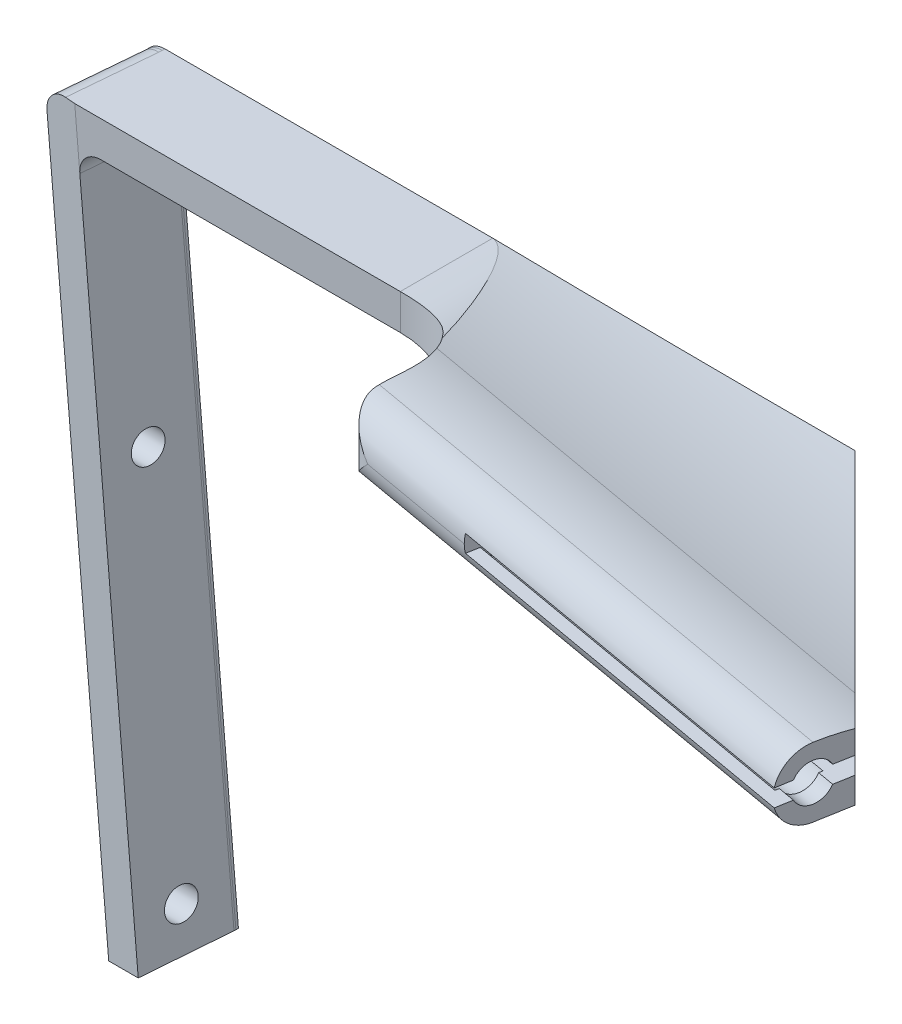
from build123d import *

# Parameters (mm, degrees)
OVERALLGEOMETRY_BOSS_EXTRUDE1_DEPTH = 0.254
CAMERAPITCH_BOSS_EXTRUDE2_DEPTH     = 56.109378
BOSS_EXTRUDE3_DEPTH                 = 5.08
SKETCH3_R                           = 1.143
CUT_EXTRUDE1_DEPTH                  = 97.064287471
CUT_EXTRUDE2_DEPTH                  = 27.94
BOSS_EXTRUDE4_DEPTH                 = 1.27
CUT_EXTRUDE4_DEPTH                  = 95.187753464
CUT_EXTRUDE5_DEPTH                  = 98.850191818
FILLET1_R                           = 2.54
FILLET2_R                           = 7.62
SKETCH10_R                          = 51.133924518
CUT_EXTRUDE6_DEPTH                  = 95.075440862
FILLET3_R                           = 2.54
FILLET4_R                           = 17.78
CUT_EXTRUDE8_DEPTH                  = 94.555694116
CUT_EXTRUDE8_DEPTH_BACK             = 94.555694116
FILLET14_R                          = 1.524
FILLET15_R                          = 1.524
FILLET16_R                          = 1.524
FILLET17_R                          = 1.524


with BuildPart() as part:
    # Sketch1 → OverallGeometry-Boss-Extrude1 (new body)
    with BuildSketch(Plane.XY):
        Polygon((0, 0), (76.2, 0), (76.2, -5.08), (2.853610021, -5.08), (7.281121752, -55.686690663), (4.890254477, -55.895864446), align=None)
    extrude(amount=OVERALLGEOMETRY_BOSS_EXTRUDE1_DEPTH)

    # Sketch2 → CameraPitch-Boss-Extrude2 (add)
    with BuildSketch(Plane(origin=(4.890254477, -55.895864446, 0), x_dir=(0.9961946980917449, 0.08715574274766635, 0), z_dir=(0.08715574274766635, -0.9961946980917449, 0))):
        Polygon((2.4, 0.254), (1.828330337, 6.788214146), (-0.553438966, 6.579836333), (0, 0.254), align=None)
    extrude(amount=-CAMERAPITCH_BOSS_EXTRUDE2_DEPTH)

    # Sketch4 → Boss-Extrude3 (add)
    with BuildSketch(Plane.XZ.offset(5.08)):
        Polygon((76.2, 0.254), (71.789336287, 25.268116927), (33.571372988, 18.529258849), (33.571372988, 6.788214146), (-1.988627012, 6.788214146), (-1.419132725, 0.254), (-1.419132725, 0), (76.2, 0), align=None)
    extrude(amount=-BOSS_EXTRUDE3_DEPTH)

    # Sketch3 → Cut-Extrude1 (cut, through all)
    with BuildSketch(Plane(origin=(2.394675351, 0.209506946, 0.210307229), x_dir=(0.1097410378717943, -0.30459177963520256, -0.9461399222025683), z_dir=(0.9924038765061032, 0.08682408883347342, 0.08715574274766114))):
        with Locations(Location((4.583283833, -24.85972329, 0), (0, 0, 17.803073687))):
            Circle(SKETCH3_R)
        with Locations(Location((13.32842777, -51.395850692, 0), (0, 0, 17.803073687))):
            Circle(SKETCH3_R)
    extrude(amount=-CUT_EXTRUDE1_DEPTH, mode=Mode.SUBTRACT)

    # Sketch5 → Cut-Extrude2 (cut)
    with BuildSketch(Plane(origin=(73.94572541, 0, 13.038626498), x_dir=(0.1736481776669353, 0, -0.9848077530122074), z_dir=(0.9848077530122074, 0, 0.1736481776669353))):
        with BuildLine():
            Line((-12.418150031, -1.905), (-11.402150031, -1.905))
            ThreePointArc((-11.402150031, -1.905), (-9.878150031, -0.889), (-8.354150031, -1.905))
            Line((-8.354150031, -1.905), (-4.544150031, -1.905))
            Line((-4.544150031, -1.905), (-4.544150031, -3.175))
            Line((-4.544150031, -3.175), (-8.354150031, -3.175))
            ThreePointArc((-8.354150031, -3.175), (-9.878150031, -4.191), (-11.402150031, -3.175))
            Line((-11.402150031, -3.175), (-12.418150031, -3.175))
            Line((-12.418150031, -3.175), (-12.418150031, -1.905))
        make_face()
    extrude(amount=-CUT_EXTRUDE2_DEPTH, mode=Mode.SUBTRACT)

    # Sketch6 → Boss-Extrude4 (add)
    with BuildSketch(Plane(origin=(73.94572541, 0, 13.038626498), x_dir=(0.1736481776669353, 0, -0.9848077530122074), z_dir=(0.9848077530122074, 0, 0.1736481776669353))):
        with BuildLine():
            Line((-11.402150031, -1.905), (-11.12249082, -1.905))
            ThreePointArc((-11.12249082, -1.905), (-9.878150031, -1.143), (-8.633809242, -1.905))
            Line((-8.633809242, -1.905), (-8.354150031, -1.905))
            ThreePointArc((-8.354150031, -1.905), (-9.878150031, -0.889), (-11.402150031, -1.905))
        make_face()
        with BuildLine():
            Line((-8.354150031, -3.175), (-8.633809242, -3.175))
            ThreePointArc((-8.633809242, -3.175), (-9.878150031, -3.937), (-11.12249082, -3.175))
            Line((-11.12249082, -3.175), (-11.402150031, -3.175))
            ThreePointArc((-11.402150031, -3.175), (-9.878150031, -4.191), (-8.354150031, -3.175))
        make_face()
    extrude(amount=-BOSS_EXTRUDE4_DEPTH)

    # Sketch8 → Cut-Extrude4 (cut, through all)
    with BuildSketch(Plane(origin=(4.890254477, -55.895864446, 0), x_dir=(0.9961946980917449, 0.08715574274766635, 0), z_dir=(0.08715574274766635, -0.9961946980917449, 0))):
        Polygon((1.828330337, 6.788214146), (-0.553438966, 6.579836333), (0, 0.254), (0, 0), (-7.348278785, 0), (-7.348278785, 6.788214146), align=None)
    extrude(amount=-CUT_EXTRUDE4_DEPTH, mode=Mode.SUBTRACT)

    # Sketch9 → Cut-Extrude5 (cut, through all)
    with BuildSketch(Plane(origin=(0, 0, 0), x_dir=(1, 0, 0), z_dir=(0, 1, 0))):
        Polygon((72.693522348, -20.140222957), (52.553299392, 0), (76.2, 0), (76.2, -20.140222957), align=None)
    extrude(amount=-CUT_EXTRUDE5_DEPTH, mode=Mode.SUBTRACT)

    # Fillet1
    fillet1_edges = [part.edges().sort_by_distance(p)[0] for p in [
        (33.571372988, -2.54, 18.529258849),
    ]]
    fillet(fillet1_edges, radius=FILLET1_R)

    # Fillet2
    fillet2_edges = [part.edges().sort_by_distance(p)[0] for p in [
        (33.571372988, -2.54, 6.788214146),
    ]]
    fillet(fillet2_edges, radius=FILLET2_R)

    # Sketch10 → Cut-Extrude6 (cut, through all)
    with BuildSketch(Plane(origin=(73.94572541, 0, 13.038626498), x_dir=(0.1736481776669353, 0, -0.9848077530122074), z_dir=(0.9848077530122074, 0, 0.1736481776669353))):
        with Locations((9.12578467, 48.453924518)):
            Circle(SKETCH10_R)
    extrude(amount=-CUT_EXTRUDE6_DEPTH, mode=Mode.SUBTRACT)

    # Fillet3
    # the kernel refuses this fillet: 2.54 mm, written as the material it takes off along each edge
    with BuildSketch(Plane(origin=(78.042865519, 0, 26.370782855), x_dir=(0, -1, 0), z_dir=(-0.9848077530122074, 0, -0.17364817766693483)), Plane(origin=(78.042865519, -5.08, 26.370782855), x_dir=(0.1736481776669348, 0, -0.9848077530122072), z_dir=(-0.9848077530122074, 0, -0.17364817766693483))) as fillet3_piece_1:
        with BuildLine():
            CenterArc((FILLET3_R, -FILLET3_R), FILLET3_R, 90, 90)
            Line((0, -FILLET3_R), (0, 0))
            Line((0, 0), (FILLET3_R, 0))
        make_face()
    extrude(amount=49.376223923, mode=Mode.SUBTRACT)

    # Fillet4
    # the kernel refuses this fillet: 17.78 mm, written as the material it takes off along each edge
    with BuildSketch(Plane(origin=(26.924174105, 0, 12.069851972), x_dir=(-0.17364817766672255, -1.5652114621324412e-06, 0.9848077530110009), z_dir=(0.9848077530122074, 0, 0.1736481776669353))) as fillet4_piece_1:
        with BuildLine():
            CenterArc((2.69463399, 17.779970779), FILLET4_R, 253.968520973, 15.92760212)
            Line((-2.215587596, 0.691432984), (-2.706609755, -1.017420796))
            ThreePointArc((-2.706609755, -1.017420796), (-1.633548438, -1.338981063), (-0.568061322, -1.684811662))
            Line((-0.568061322, -1.684811662), (-2.783e-06, -1.778))
            ThreePointArc((-2.783e-06, -1.778), (2.666997217, -1.778004174), (2.659175472, -1.777997078))
            Line((2.659175472, -1.777997078), (2.662398973, 0))
        make_face()
    extrude(amount=53.131411648, mode=Mode.SUBTRACT)

    # Sketch13 → Cut-Extrude8 (cut, two sides: drawn at the far end of the back side and taken through both)
    with BuildSketch(Plane.XY.offset(6.788214146).offset(-CUT_EXTRUDE8_DEPTH_BACK)):
        with BuildLine():
            Line((-24.848627012, 22.929081842), (25.951372988, 22.929081842))
            ThreePointArc((25.951372988, 22.929081842), (38.651372988, 10.229081842), (25.951372988, -2.470918158))
            Line((25.951372988, -2.470918158), (-24.848627012, -2.470918158))
            ThreePointArc((-24.848627012, -2.470918158), (-37.548627012, 10.229081842), (-24.848627012, 22.929081842))
        make_face()
    extrude(amount=CUT_EXTRUDE8_DEPTH + CUT_EXTRUDE8_DEPTH_BACK, mode=Mode.SUBTRACT)

    # Fillet14
    # the kernel refuses this fillet: 1.524 mm, written as the material it takes off along each edge
    with BuildSketch(Plane(origin=(2.839111821, -4.914284813, 0.254), x_dir=(0, 0, -1), z_dir=(0.08715574274766345, -0.9961946980917451, 0))) as fillet14_piece_1_section:
        with BuildLine():
            CenterArc((FILLET14_R * 0.0436609429085, -FILLET14_R), FILLET14_R, 90, 5)
            Line((-FILLET14_R * 0.0434947998391, -FILLET14_R * 0.00380530190825), (0, 0))
            Line((0, 0), (FILLET14_R * 0.0436609429085, 0))
        make_face()
    fillet14_piece_1 = extrude(amount=51.132696385, mode=Mode.PRIVATE)
    fillet14_piece_1 = split(fillet14_piece_1, bisect_by=Plane(origin=(5.088209077, -5.08, 0.254593638), z_dir=(0, -1, 0)), keep=Keep.TOP, mode=Mode.PRIVATE)
    add(fillet14_piece_1, mode=Mode.SUBTRACT)

    # Fillet15
    fillet15_edges = [part.edges().sort_by_distance(p)[0] for p in [
        (2.563772631, -5.08, 3.554250111),
        (2.853610021, -5.08, 0.093730362),
        (2.852153949, -5.08, 0.253937152),
    ]]
    fillet(fillet15_edges, radius=FILLET15_R)

    # Fillet16
    # the kernel refuses this fillet: 1.524 mm, written as the material it adds along each edge
    with BuildSketch(Plane(origin=(4.890254477, -55.895864446, 0.254), x_dir=(0, 0, -1), z_dir=(-0.08715574274766158, 0.9961946980917453, 0))) as fillet16_piece_1:
        with BuildLine():
            CenterArc((FILLET16_R * 0.0436609429085, FILLET16_R), FILLET16_R, 265, 5)
            Line((-FILLET16_R * 0.0434947998391, FILLET16_R * 0.00380530190826), (0, 0))
            Line((0, 0), (FILLET16_R * 0.0436609429085, 0))
        make_face()
    extrude(amount=51.009972792)
    with BuildSketch(Plane(origin=(0.444442411, -5.08, 0.254), x_dir=(-0.08682408883346991, -0.007596123493897102, 0.9961946980917452), z_dir=(-0.08715574274766635, 0.9961946980917449, 0))) as fillet16_piece_2_section:
        with BuildLine():
            CenterArc((FILLET16_R * 0.043660942909, -FILLET16_R), FILLET16_R, 90, 5)
            Line((-FILLET16_R * 0.0434947998397, -FILLET16_R * 0.00380530190835), (0, 0))
            Line((0, 0), (FILLET16_R * 0.043660942909, 0))
        make_face()
    fillet16_piece_2 = extrude(amount=2.785396303, mode=Mode.PRIVATE)
    fillet16_piece_2 = split(fillet16_piece_2, bisect_by=Plane(origin=(0.343901327, -2.470918158, 0.25459558), z_dir=(0, -1, 0)), keep=Keep.TOP, mode=Mode.PRIVATE)
    add(fillet16_piece_2)

    # Fillet17
    fillet17_edges = [part.edges().sort_by_distance(p)[0] for p in [
        (0.216177327, -2.470918158, 0.093730362),
        (0.214721255, -2.470918158, 0.253937152),
        (-0.064509896, -2.470918158, 3.450061204),
    ]]
    fillet(fillet17_edges, radius=FILLET17_R)


solid = part.part
